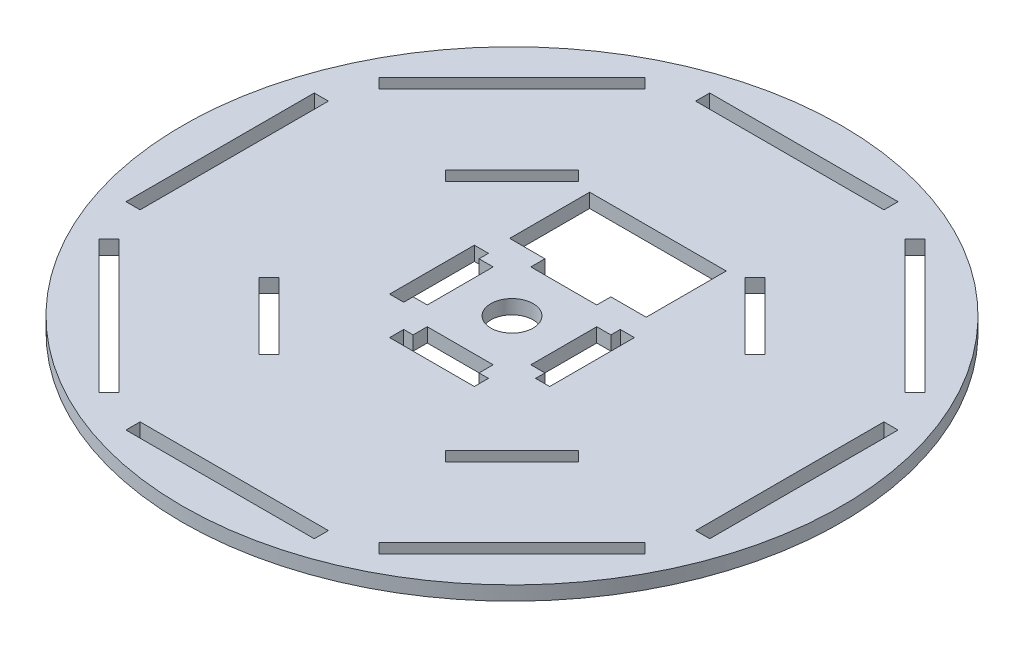
from build123d import *

# Parameters (mm, degrees)
CROQUIS1_R              = 70
CROQUIS1_R_2            = 4.5
SALIENTE_EXTRUIR1_DEPTH = 3


with BuildPart() as part:
    # Croquis1 → Saliente-Extruir1 (new body)
    with BuildSketch(Plane(origin=(0, 0, 0), x_dir=(1, 0, 0), z_dir=(0, 1, 0))):
        Circle(CROQUIS1_R)
        Circle(CROQUIS1_R_2, mode=Mode.SUBTRACT)
        Polygon((0, 11), (7, 11), (7, 14), (14.5, 14), (14.5, 31), (-14.5, 31), (-14.5, 14), (-7, 14), (-7, 11), align=None, mode=Mode.SUBTRACT)
        Polygon((24.748737342, 24.748737342), (31.819805153, 17.67766953), (33.941125497, 19.798989873), (19.798989873, 33.941125497), (17.67766953, 31.819805153), align=None, mode=Mode.SUBTRACT)
        Polygon((11, 0), (11, 7), (14, 7), (14, 9), (17, 9), (17, 0), (17, -9), (14, -9), (14, -7), (11, -7), align=None, mode=Mode.SUBTRACT)
        Polygon((-24.748737342, 24.748737342), (-17.67766953, 31.819805153), (-19.798989873, 33.941125497), (-33.941125497, 19.798989873), (-31.819805153, 17.67766953), align=None, mode=Mode.SUBTRACT)
        Polygon((-14, -7), (-11, -7), (-11, 0), (-11, 7), (-14, 7), (-14, 9), (-17, 9), (-17, -9), (-14, -9), align=None, mode=Mode.SUBTRACT)
        Polygon((-7, -14), (-9, -14), (-9, -17), (0, -17), (9, -17), (9, -14), (7, -14), (7, -11), (0, -11), (-7, -11), align=None, mode=Mode.SUBTRACT)
        Polygon((24.748737342, -24.748737342), (17.67766953, -31.819805153), (19.798989873, -33.941125497), (33.941125497, -19.798989873), (31.819805153, -17.67766953), align=None, mode=Mode.SUBTRACT)
        Polygon((-24.748737342, -24.748737342), (-31.819805153, -17.67766953), (-33.941125497, -19.798989873), (-19.798989873, -33.941125497), (-17.67766953, -31.819805153), align=None, mode=Mode.SUBTRACT)
        Polygon((0, 62), (20, 62), (20, 59), (-20, 59), (-20, 62), align=None, mode=Mode.SUBTRACT)
        Polygon((55.861435714, 27.577164466), (27.577164466, 55.861435714), (29.69848481, 57.982756057), (43.840620434, 43.840620434), (57.982756057, 29.69848481), align=None, mode=Mode.SUBTRACT)
        Polygon((59, -20), (59, 20), (62, 20), (62, 0), (62, -20), align=None, mode=Mode.SUBTRACT)
        Polygon((27.577164466, -55.861435714), (55.861435714, -27.577164466), (57.982756057, -29.69848481), (43.840620434, -43.840620434), (29.69848481, -57.982756057), align=None, mode=Mode.SUBTRACT)
        Polygon((-20, -59), (20, -59), (20, -62), (0, -62), (-20, -62), align=None, mode=Mode.SUBTRACT)
        Polygon((-55.861435714, -27.577164466), (-27.577164466, -55.861435714), (-29.69848481, -57.982756057), (-43.840620434, -43.840620434), (-57.982756057, -29.69848481), align=None, mode=Mode.SUBTRACT)
        Polygon((-59, 20), (-59, -20), (-62, -20), (-62, 0), (-62, 20), align=None, mode=Mode.SUBTRACT)
        Polygon((-27.577164466, 55.861435714), (-55.861435714, 27.577164466), (-57.982756057, 29.69848481), (-43.840620434, 43.840620434), (-29.69848481, 57.982756057), align=None, mode=Mode.SUBTRACT)
    extrude(amount=SALIENTE_EXTRUIR1_DEPTH)


solid = part.part
